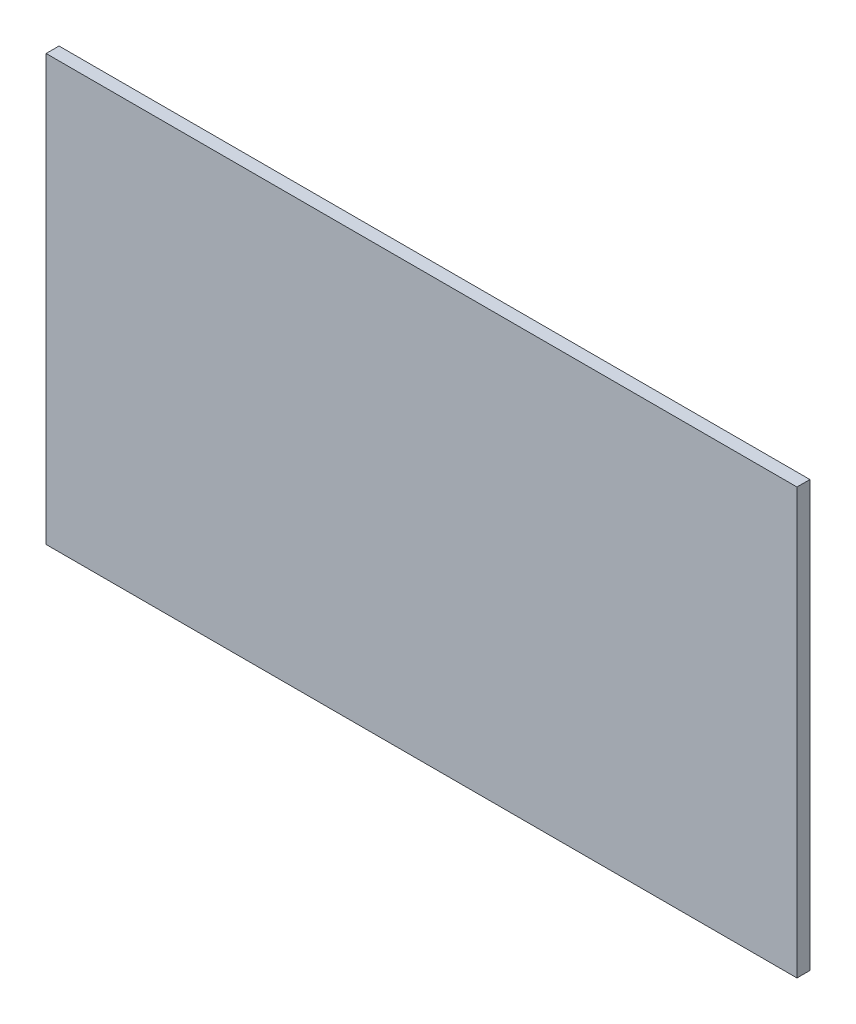
from build123d import *

# Parameters (mm, degrees)
ESQUISSE1_W        = 377
ESQUISSE1_H        = 213.5
BOSS_EXTRU_1_DEPTH = 6.5


with BuildPart() as part:
    # Esquisse1 → Boss.-Extru.1 (new body)
    with BuildSketch(Plane.XY):
        with Locations((-1.157256387, -28.057106599)):
            Rectangle(ESQUISSE1_W, ESQUISSE1_H)
    extrude(amount=BOSS_EXTRU_1_DEPTH)


solid = part.part
